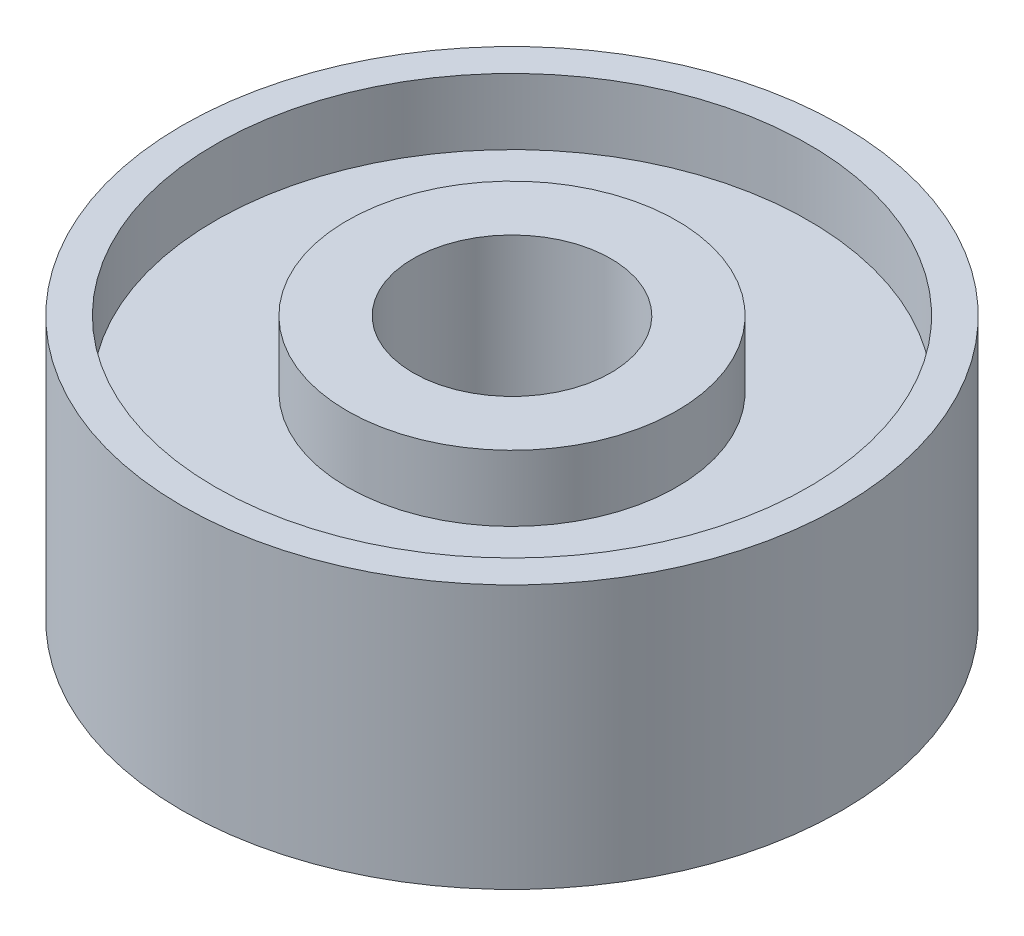
from build123d import *

# Parameters (mm, degrees)
SKETCH_1_R          = 5
SKETCH_1_R_2        = 1.5
EXTRUDE_1_DEPTH     = 4
SKETCH_2_R          = 4.5
SKETCH_2_R_2        = 2.5
CUT_EXTRUDE_1_DEPTH = 1
CUT_EXTRUDE_START   = -1
SKETCH_3_R          = 4.5
SKETCH_3_R_2        = 2.5
CUT_EXTRUDE_2_DEPTH = 1


with BuildPart() as part:
    # Эскиз1 → Бобышка-Вытянуть1 (new body)
    with BuildSketch(Plane(origin=(0, 0, 0), x_dir=(1, 0, 0), z_dir=(0, 1, 0))):
        Circle(SKETCH_1_R)
        Circle(SKETCH_1_R_2, mode=Mode.SUBTRACT)
    extrude(amount=EXTRUDE_1_DEPTH)

    # Эскиз2 → Вырез-Вытянуть1 (cut)
    with BuildSketch(Plane(origin=(0, 4, 0), x_dir=(1, 0, 0), z_dir=(0, 1, 0))):
        Circle(SKETCH_2_R)
        Circle(SKETCH_2_R_2, mode=Mode.SUBTRACT)
    extrude(amount=-CUT_EXTRUDE_1_DEPTH, mode=Mode.SUBTRACT)

    # Эскиз3 → Вырез-Вытянуть2 (cut)
    with BuildSketch(Plane.XZ.offset(CUT_EXTRUDE_START)):
        Circle(SKETCH_3_R)
        Circle(SKETCH_3_R_2, mode=Mode.SUBTRACT)
    extrude(amount=CUT_EXTRUDE_2_DEPTH, mode=Mode.SUBTRACT)


solid = part.part
